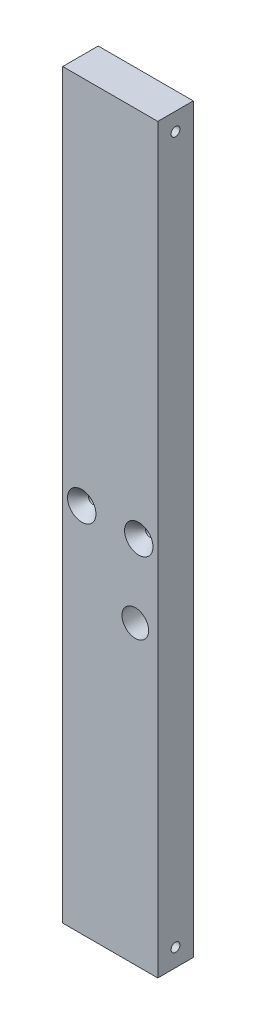
from build123d import *

# Parameters (mm, degrees)
SKETCH1_W                    = 34
SKETCH1_H                    = 265.399999988
BOSS_EXTRUDE1_DEPTH          = 12.7
F_3_8_0_375_DIAMETER_HOLE1_D = 9.525
HOLE1_D                      = 3.175
HOLE1_DEPTH                  = 31.75
HOLE1_CSINK_D                = 10.16
HOLE1_CSINK_ANGLE            = 82
HOLE1_TIP                    = 0.953866233
HOLE3_D                      = 3.175
HOLE3_DEPTH                  = 31.75
HOLE3_CSINK_D                = 10.16
HOLE3_CSINK_ANGLE            = 82
HOLE3_TIP                    = 0.953866233
HOLE4_D                      = 3.175
HOLE4_DEPTH                  = 31.75
HOLE4_CSINK_D                = 10.16
HOLE4_CSINK_ANGLE            = 82
HOLE4_TIP                    = 0.953866233


with BuildPart() as part:
    # Sketch1 → Boss-Extrude1 (new body)
    with BuildSketch(Plane.XY):
        with Locations((-23.08092085, 0)):
            Rectangle(SKETCH1_W, SKETCH1_H)
    extrude(amount=-BOSS_EXTRUDE1_DEPTH)

    # 3/8 (0.375) Diameter Hole1 (through all)
    with Locations(Plane.XY):
        with Locations((-14.118005489, -26.732654045)):
            Hole(F_3_8_0_375_DIAMETER_HOLE1_D / 2)

    # Hole1
    with Locations(Plane(origin=(12.91907915, 0, 66.124290059), x_dir=(0, -1, 0), z_dir=(1, 0, 0))):
        with Locations((126.349999994, 72.474290059), (146.083333327, -84.825709941), (172.166666661, -84.825709941), (126.349999994, -54.375709941), (126.349999994, 42.024290059), (-172.166666661, -84.825709941), (-146.083333327, -84.825709941), (-126.349999994, -54.375709941), (-126.349999994, 42.024290059), (-126.349999994, 72.474290059)):
            CounterSinkHole(HOLE1_D / 2, HOLE1_CSINK_D / 2, depth=HOLE1_DEPTH, counter_sink_angle=HOLE1_CSINK_ANGLE)
            with Locations((0, 0, -(HOLE1_DEPTH + HOLE1_TIP / 2))):  # 118° drill point
                Cone(0, HOLE1_D / 2, HOLE1_TIP, mode=Mode.SUBTRACT)

    # Hole3
    with Locations(Plane(origin=(-195.367659426, 0, 0), x_dir=(0, -1, 0), z_dir=(0, 0, 1))):
        with Locations((0, 162.086738577), (0, 182.486738577)):
            CounterSinkHole(HOLE3_D / 2, HOLE3_CSINK_D / 2, depth=HOLE3_DEPTH, counter_sink_angle=HOLE3_CSINK_ANGLE)
            with Locations((0, 0, -(HOLE3_DEPTH + HOLE3_TIP / 2))):  # 118° drill point
                Cone(0, HOLE3_D / 2, HOLE3_TIP, mode=Mode.SUBTRACT)

    # Hole4
    with Locations(Plane(origin=(-52.78092085, 0, 66.124290059), x_dir=(0, 1, 0), z_dir=(-1, 0, 0))):
        with Locations((-207.774999994, 244.12141023), (-207.774999994, 136.58903684), (-207.774999994, 48.524290059), (-185.549999994, -84.825709941), (-151.749999994, -84.825709941), (-94.599999994, 72.474290059), (94.599999994, 72.474290059), (151.749999994, -84.825709941), (185.549999994, -84.825709941), (207.774999994, 48.524290059), (207.774999994, 136.58903684), (207.774999994, 244.12141023), (166.795833328, 213.070350905), (40.979166666, 213.070350905), (-40.979166666, 213.070350905), (-166.795833328, 213.070350905), (0, 104.224290059), (0, 213.070350905), (0, 323.466411751), (-126.349999994, 34.524290059), (-126.349999994, -46.875709941), (126.349999994, -46.875709941), (126.349999994, 34.524290059)):
            CounterSinkHole(HOLE4_D / 2, HOLE4_CSINK_D / 2, depth=HOLE4_DEPTH, counter_sink_angle=HOLE4_CSINK_ANGLE)
            with Locations((0, 0, -(HOLE4_DEPTH + HOLE4_TIP / 2))):  # 118° drill point
                Cone(0, HOLE4_D / 2, HOLE4_TIP, mode=Mode.SUBTRACT)


solid = part.part
